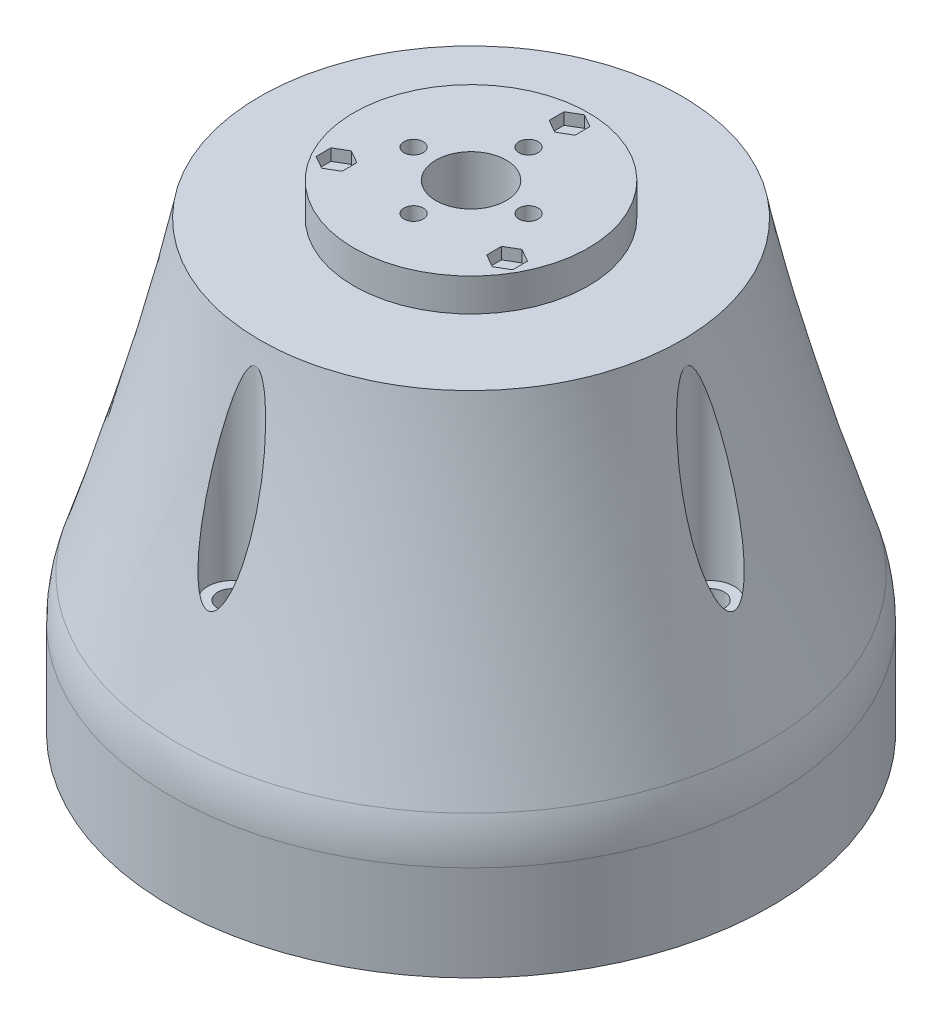
from build123d import *

# Parameters (mm, degrees)
SKETCH3_R           = 64
BOSS_EXTRUDE1_DEPTH = 15
SKETCH6_R           = 3
CUT_EXTRUDE1_DEPTH  = 85
SKETCH8_R           = 5.11
CUT_EXTRUDE3_DEPTH  = 45
CUT_EXTRUDE4_DEPTH  = 12
SKETCH17_R          = 37.5
CUT_EXTRUDE10_DEPTH = 69
BOSS_EXTRUDE3_START = 10
SKETCH19_R          = 64
SKETCH19_R_2        = 3
BOSS_EXTRUDE3_DEPTH = 10
SKETCH21_R          = 25
BOSS_EXTRUDE4_DEPTH = 7
SKETCH20_R          = 7.5
SKETCH20_R_2        = 2.05
CUT_EXTRUDE11_DEPTH = 11
CUT_EXTRUDE12_DEPTH = 2.5
SKETCH23_R          = 1.55
CUT_EXTRUDE13_DEPTH = 10


with BuildPart() as part:
    # Sketch3 → Boss-Extrude1 (new body)
    with BuildSketch(Plane(origin=(0, 0, 0), x_dir=(1, 0, 0), z_dir=(0, 1, 0))):
        with Locations(Location((0, 0, 0), (0, 0, 270))):
            Circle(SKETCH3_R)
    extrude(amount=BOSS_EXTRUDE1_DEPTH)

    # Loft1: read off the stored shape, not the designer's step
    # Loft1: loft between two sections, ruled curve by curve
    loft1_from = [
        Edge.make_bspline([(-2.572899159, 15, 63.948261821), (125.323624483, 15, 69.094060139), (130.469422801, 15, -58.802463502), (2.572899159, 15, -63.948261821), (-125.323624483, 15, -69.094060139), (-130.469422801, 15, 58.802463502), (-2.572899159, 15, 63.948261821)], [0, 0, 0, 0, 0.5, 0.5, 0.5, 1, 1, 1, 1], 3, [1, 0.333333333, 0.333333333, 1, 0.333333333, 0.333333333, 1]),
    ]
    loft1_to = [
        Edge.make_bspline([(15.879915775, 85, 42.104967343), (100.089850462, 85, 10.345135793), (68.330018911, 85, -73.864798894), (-15.879915775, 85, -42.104967343), (-100.089850462, 85, -10.345135793), (-68.330018911, 85, 73.864798894), (15.879915775, 85, 42.104967343)], [0, 0, 0, 0, 0.5, 0.5, 0.5, 1, 1, 1, 1], 3, [1, 0.333333333, 0.333333333, 1, 0.333333333, 0.333333333, 1]),
    ]
    loft1 = Solid(Shell([*[Face.make_surface_from_curves(loft1_from[k], loft1_to[k]) for k in range(1)], Face(Wire(loft1_from)), Face(Wire(loft1_to))]))
    add(loft1)

    # Fillet1: read off the stored shape, not the designer's step
    # Fillet1 outline → Fillet1 (revolve, cut)
    with BuildSketch(Plane.XY):
        with BuildLine():
            ThreePointArc((62.589980205, 19.403856432), (63.645399358, 14.913630496), (64, 10.314685299))
            Line((64, 10.314685299), (64, 19.403856432))
            Line((64, 19.403856432), (62.589980205, 19.403856432))
        make_face()
    revolve(axis=Axis((0, 0, 0), (0, 1, 0)), mode=Mode.SUBTRACT)

    # Sketch6 → Cut-Extrude1 (cut)
    with BuildSketch(Plane(origin=(0, 85, 0), x_dir=(1, 0, 0), z_dir=(0, 1, 0))):
        with Locations(Location((0, 51, 0), (0, 0, 270))):
            Circle(SKETCH6_R)
        with Locations(Location((51, 0, 0), (0, 0, 270))):
            Circle(SKETCH6_R)
        with Locations(Location((0, -51, 0), (0, 0, 270))):
            Circle(SKETCH6_R)
        with Locations(Location((-51, 0, 0), (0, 0, 270))):
            Circle(SKETCH6_R)
    extrude(amount=-CUT_EXTRUDE1_DEPTH, mode=Mode.SUBTRACT)

    # Sketch8 → Cut-Extrude3 (cut)
    with BuildSketch(Plane(origin=(0, 85, 0), x_dir=(1, 0, 0), z_dir=(0, 1, 0))):
        with Locations(Location((-51, 0, 0), (0, 0, 270))):
            Circle(SKETCH8_R)
        with Locations(Location((0, 51, 0), (0, 0, 270))):
            Circle(SKETCH8_R)
        with Locations(Location((51, 0, 0), (0, 0, 270))):
            Circle(SKETCH8_R)
        with Locations(Location((0, -51, 0), (0, 0, 270))):
            Circle(SKETCH8_R)
    extrude(amount=-CUT_EXTRUDE3_DEPTH, mode=Mode.SUBTRACT)

    # Sketch9 → Cut-Extrude4 (cut)
    with BuildSketch(Plane.XZ):
        with BuildLine():
            ThreePointArc((-16.468393868, 53.523751769), (-39.597979746, 39.597979746), (-53.523751769, 16.468393868))
            ThreePointArc((-53.523751769, 16.468393868), (-53.012195037, 10.80781258), (-48.677696078, 7.131402702))
            ThreePointArc((-48.677696078, 7.131402702), (-43.5, 0), (-48.677696078, -7.131402702))
            ThreePointArc((-48.677696078, -7.131402702), (-53.012195037, -10.80781258), (-53.523751769, -16.468393868))
            ThreePointArc((-53.523751769, -16.468393868), (-39.597979746, -39.597979746), (-16.468393868, -53.523751769))
            ThreePointArc((-16.468393868, -53.523751769), (-10.80781258, -53.012195037), (-7.131402702, -48.677696078))
            ThreePointArc((-7.131402702, -48.677696078), (0, -43.5), (7.131402702, -48.677696078))
            ThreePointArc((7.131402702, -48.677696078), (10.80781258, -53.012195037), (16.468393868, -53.523751769))
            ThreePointArc((16.468393868, -53.523751769), (39.597979746, -39.597979746), (53.523751769, -16.468393868))
            ThreePointArc((53.523751769, -16.468393868), (53.012195037, -10.80781258), (48.677696078, -7.131402702))
            ThreePointArc((48.677696078, -7.131402702), (43.5, 0), (48.677696078, 7.131402702))
            ThreePointArc((48.677696078, 7.131402702), (53.012195037, 10.80781258), (53.523751769, 16.468393868))
            ThreePointArc((53.523751769, 16.468393868), (39.597979746, 39.597979746), (16.468393868, 53.523751769))
            ThreePointArc((16.468393868, 53.523751769), (10.80781258, 53.012195037), (7.131402702, 48.677696078))
            ThreePointArc((7.131402702, 48.677696078), (0, 43.5), (-7.131402702, 48.677696078))
            ThreePointArc((-7.131402702, 48.677696078), (-10.80781258, 53.012195037), (-16.468393868, 53.523751769))
        make_face()
    extrude(amount=-CUT_EXTRUDE4_DEPTH, mode=Mode.SUBTRACT)

    # Sketch17 → Cut-Extrude10 (cut)
    with BuildSketch(Plane.XZ.offset(-12)):
        with Locations(Location((0, 0, 0), (0, 0, 270))):
            Circle(SKETCH17_R)
    extrude(amount=-CUT_EXTRUDE10_DEPTH, mode=Mode.SUBTRACT)

    # Sketch19 → Boss-Extrude3 (add)
    with BuildSketch(Plane.XZ.offset(BOSS_EXTRUDE3_START)):
        with Locations(Location((0, 0, 0), (0, 0, 270))):
            Circle(SKETCH19_R)
        with Locations(Location((51, 0, 0), (0, 0, 90))):
            Circle(SKETCH19_R_2, mode=Mode.SUBTRACT)
        with Locations(Location((-51, 0, 0), (0, 0, 90))):
            Circle(SKETCH19_R_2, mode=Mode.SUBTRACT)
        with Locations(Location((0, 51, 0), (0, 0, 90))):
            Circle(SKETCH19_R_2, mode=Mode.SUBTRACT)
        with Locations(Location((0, -51, 0), (0, 0, 90))):
            Circle(SKETCH19_R_2, mode=Mode.SUBTRACT)
        with BuildLine():
            ThreePointArc((-16.468393868, 53.523751769), (-10.80781258, 53.012195037), (-7.131402702, 48.677696078))
            ThreePointArc((-7.131402702, 48.677696078), (0, 43.5), (7.131402702, 48.677696078))
            ThreePointArc((7.131402702, 48.677696078), (10.80781258, 53.012195037), (16.468393868, 53.523751769))
            ThreePointArc((16.468393868, 53.523751769), (39.597979746, 39.597979746), (53.523751769, 16.468393868))
            ThreePointArc((53.523751769, 16.468393868), (53.012195037, 10.80781258), (48.677696078, 7.131402702))
            ThreePointArc((48.677696078, 7.131402702), (43.5, 0), (48.677696078, -7.131402702))
            ThreePointArc((48.677696078, -7.131402702), (53.012195037, -10.80781258), (53.523751769, -16.468393868))
            ThreePointArc((53.523751769, -16.468393868), (39.597979746, -39.597979746), (16.468393868, -53.523751769))
            ThreePointArc((16.468393868, -53.523751769), (10.80781258, -53.012195037), (7.131402702, -48.677696078))
            ThreePointArc((7.131402702, -48.677696078), (0, -43.5), (-7.131402702, -48.677696078))
            ThreePointArc((-7.131402702, -48.677696078), (-10.80781258, -53.012195037), (-16.468393868, -53.523751769))
            ThreePointArc((-16.468393868, -53.523751769), (-39.597979746, -39.597979746), (-53.523751769, -16.468393868))
            ThreePointArc((-53.523751769, -16.468393868), (-53.012195037, -10.80781258), (-48.677696078, -7.131402702))
            ThreePointArc((-48.677696078, -7.131402702), (-43.5, 0), (-48.677696078, 7.131402702))
            ThreePointArc((-48.677696078, 7.131402702), (-53.012195037, 10.80781258), (-53.523751769, 16.468393868))
            ThreePointArc((-53.523751769, 16.468393868), (-39.597979746, 39.597979746), (-16.468393868, 53.523751769))
        make_face(mode=Mode.SUBTRACT)
    extrude(amount=-BOSS_EXTRUDE3_DEPTH)

    # Sketch21 → Boss-Extrude4 (add)
    with BuildSketch(Plane(origin=(0, 85, 0), x_dir=(1, 0, 0), z_dir=(0, 1, 0))):
        with Locations(Location((0, 0, 0), (0, 0, 270))):
            Circle(SKETCH21_R)
    extrude(amount=BOSS_EXTRUDE4_DEPTH)

    # Sketch20 → Cut-Extrude11 (cut)
    with BuildSketch(Plane(origin=(0, 92, 0), x_dir=(1, 0, 0), z_dir=(0, 1, 0))):
        with Locations(Location((0, 0, 0), (0, 0, 270))):
            Circle(SKETCH20_R)
        with Locations(Location((0, 12.25, 0), (0, 0, 270))):
            Circle(SKETCH20_R_2)
        with Locations(Location((12.25, 0, 0), (0, 0, 270))):
            Circle(SKETCH20_R_2)
        with Locations(Location((0, -12.25, 0), (0, 0, 270))):
            Circle(SKETCH20_R_2)
        with Locations(Location((-12.25, 0, 0), (0, 0, 270))):
            Circle(SKETCH20_R_2)
    extrude(amount=-CUT_EXTRUDE11_DEPTH, mode=Mode.SUBTRACT)

    # Sketch22 → Cut-Extrude12 (cut)
    with BuildSketch(Plane(origin=(0, 92, 0), x_dir=(1, 0, 0), z_dir=(0, 1, 0))):
        Polygon((15.445008309, -12.102302429), (18.203405503, -13.675381657), (20.944930673, -12.073079228), (20.92805865, -8.897697571), (18.169661456, -7.324618343), (15.428136286, -8.926920772), align=None)
        Polygon((2.758397193, 19.426920772), (2.74152517, 22.602302429), (-0.016872023, 24.175381657), (-2.758397193, 22.573079228), (-2.74152517, 19.397697571), (0.016872023, 17.824618343), align=None)
        Polygon((-18.203405503, -7.324618343), (-20.944930673, -8.926920772), (-20.92805865, -12.102302429), (-18.169661456, -13.675381657), (-15.428136286, -12.073079228), (-15.445008309, -8.897697571), align=None)
    extrude(amount=-CUT_EXTRUDE12_DEPTH, mode=Mode.SUBTRACT)

    # Sketch23 → Cut-Extrude13 (cut)
    with BuildSketch(Plane.XZ.offset(-12)):
        with Locations(Location((30.0520382, 30.0520382, 0), (0, 0, 270))):
            Circle(SKETCH23_R)
        with Locations(Location((10.999809417, -41.051847617, 0), (0, 0, 270))):
            Circle(SKETCH23_R)
        with Locations(Location((-41.051847617, 10.999809417, 0), (0, 0, 270))):
            Circle(SKETCH23_R)
    extrude(amount=-CUT_EXTRUDE13_DEPTH, mode=Mode.SUBTRACT)


solid = part.part
